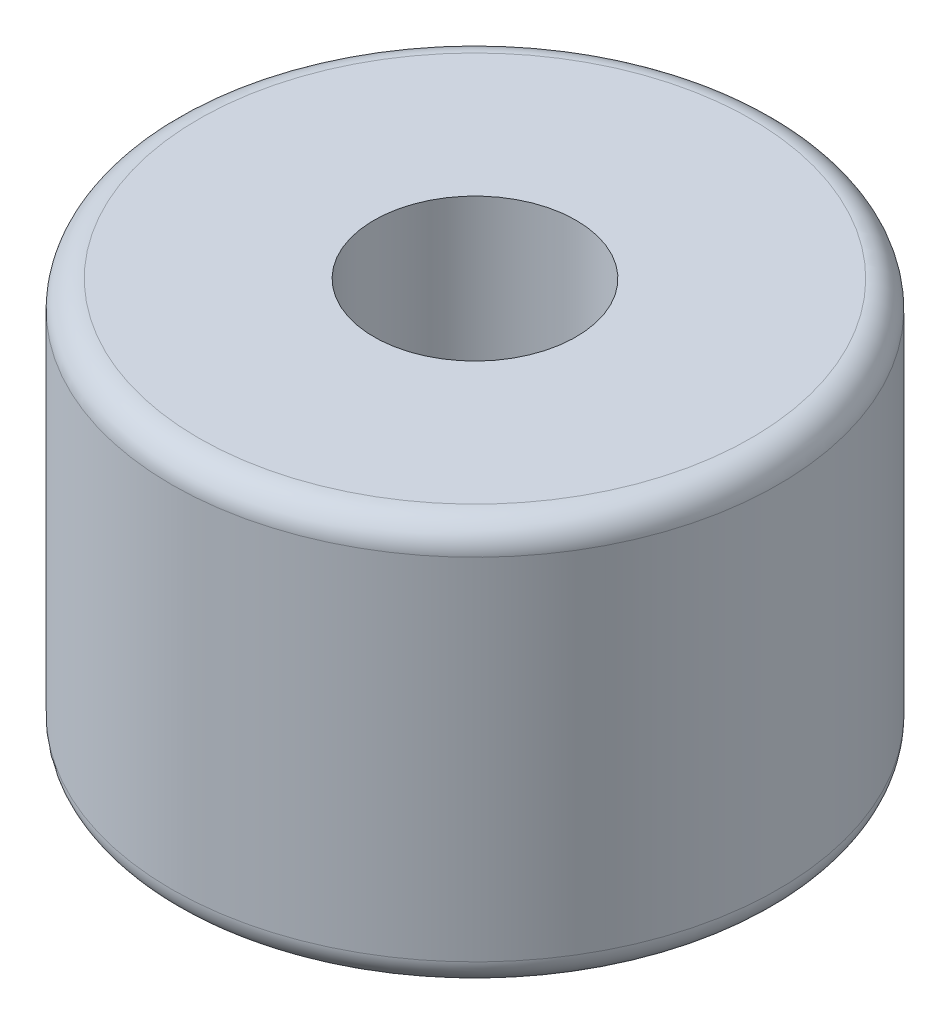
from build123d import *

# Parameters (mm, degrees)
SKETCH2_W = 4.7625
SKETCH2_H = 9.525
FILLET1_R = 0.635


with BuildPart() as part:
    # Sketch2 → Revolve1 (revolve)
    with BuildSketch(Plane.XY):
        with Locations((4.7625, 4.7625)):
            Rectangle(SKETCH2_W, SKETCH2_H)
    revolve(axis=Axis((0, 0, 0), (0, 1, 0)))

    # Fillet1
    fillet1_edges = [part.edges().sort_by_distance(p)[0] for p in [
        (-7.14375, 0, 0),
        (-7.14375, 9.525, 0),
    ]]
    fillet(fillet1_edges, radius=FILLET1_R)


solid = part.part
